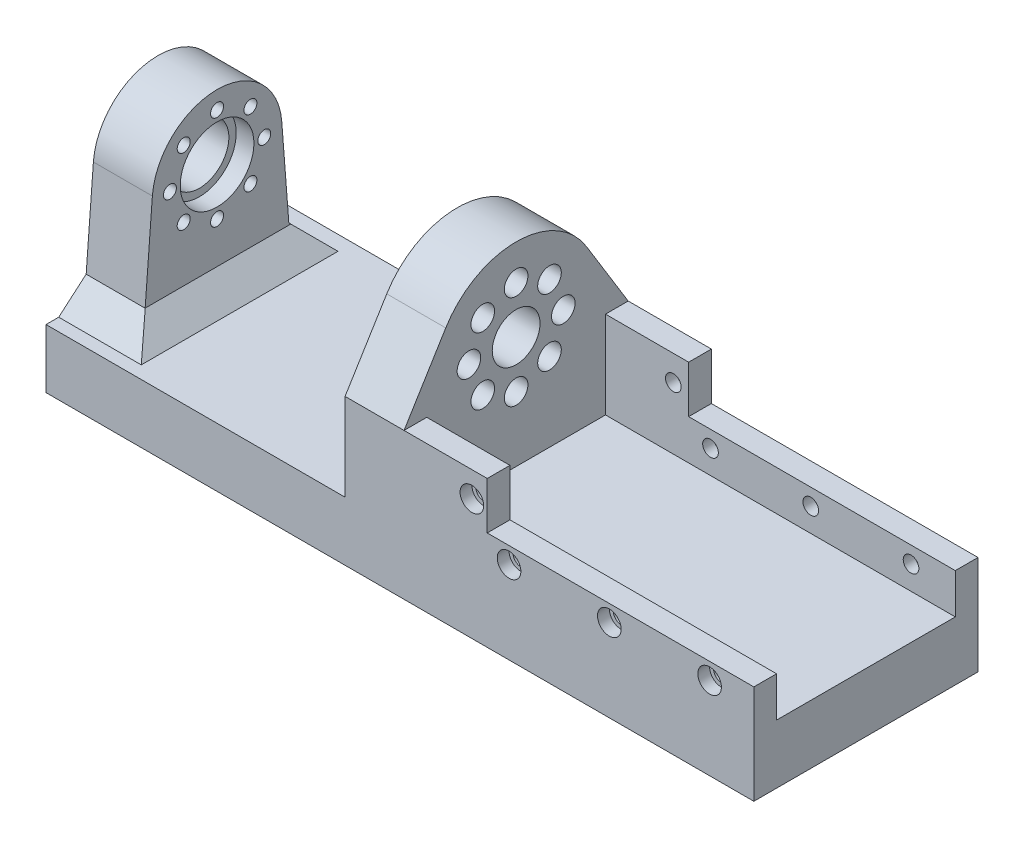
from build123d import *
from OCP.BRepFilletAPI import BRepFilletAPI_MakeChamfer

# Parameters (mm, degrees)
SKETCH1_W                = 120
SKETCH1_H                = 38
BOSS_EXTRUDE1_DEPTH      = 10
SKETCH3_R                = 4.05
BOSS_EXTRUDE2_DEPTH      = 10
SKETCH4_R                = 1.1
CUT_EXTRUDE1_DEPTH       = 133.075735849
SKETCH5_R                = 2
CUT_EXTRUDE2_DEPTH       = 5.6
CIRPATTERN2_COUNT        = 8
MIRROR1_COPY_1_SKETCH_R  = 1.1
MIRROR1_COPY_1_DEPTH     = 133.075735849
MIRROR1_COPY_2_SKETCH_R  = 1.1
MIRROR1_COPY_2_DEPTH     = 133.075735849
MIRROR1_COPY_3_SKETCH_R  = 1.1
MIRROR1_COPY_3_DEPTH     = 133.075735849
MIRROR1_COPY_4_SKETCH_R  = 1.1
MIRROR1_COPY_4_DEPTH     = 133.075735849
MIRROR1_COPY_5_SKETCH_R  = 1.1
MIRROR1_COPY_5_DEPTH     = 133.075735849
MIRROR1_COPY_6_SKETCH_R  = 1.1
MIRROR1_COPY_6_DEPTH     = 133.075735849
MIRROR1_COPY_7_SKETCH_R  = 1.1
MIRROR1_COPY_7_DEPTH     = 133.075735849
MIRROR1_COPY_8_SKETCH_R  = 2
MIRROR1_COPY_8_DEPTH     = 5.6
MIRROR1_COPY_9_SKETCH_R  = 2
MIRROR1_COPY_9_DEPTH     = 5.6
MIRROR1_COPY_10_SKETCH_R = 2
MIRROR1_COPY_10_DEPTH    = 5.6
MIRROR1_COPY_11_SKETCH_R = 2
MIRROR1_COPY_11_DEPTH    = 5.6
MIRROR1_COPY_12_SKETCH_R = 2
MIRROR1_COPY_12_DEPTH    = 5.6
MIRROR1_COPY_13_SKETCH_R = 2
MIRROR1_COPY_13_DEPTH    = 5.6
MIRROR1_COPY_14_SKETCH_R = 2
MIRROR1_COPY_14_DEPTH    = 5.6
SKETCH6_W                = 3.85
SKETCH6_H                = 6.8
BOSS_EXTRUDE3_DEPTH      = 69.3
SKETCH7_R                = 1.325
CUT_EXTRUDE3_DEPTH       = 133.075735849
CHAMFER2_SIZE            = 4
CHAMFER2_SIZE2           = 4.347650763
CHAMFER3_SIZE            = 4
SKETCH10_W               = 24.1
SKETCH10_H               = 8
BOSS_EXTRUDE5_DEPTH      = 3.85
SKETCH12_R               = 1.325
CUT_EXTRUDE5_DEPTH       = 133.075735849
SKETCH13_R               = 2
CUT_EXTRUDE6_DEPTH       = 2
SKETCH14_W               = 24.1
SKETCH14_H               = 8
BOSS_EXTRUDE6_DEPTH      = 3.85
BOSS_EXTRUDE7_DEPTH      = 10
SKETCH17_R               = 6.25
CUT_EXTRUDE8_DEPTH       = 3
SKETCH18_R               = 5
CUT_EXTRUDE9_DEPTH       = 10


with BuildPart() as part:
    # Sketch1 → Boss-Extrude1 (new body)
    with BuildSketch(Plane(origin=(0, 0, 0), x_dir=(1, 0, 0), z_dir=(0, 1, 0))):
        with Locations((60, 19)):
            Rectangle(SKETCH1_W, SKETCH1_H)
    extrude(amount=BOSS_EXTRUDE1_DEPTH)

    # Sketch3 → Boss-Extrude2 (add)
    with BuildSketch(Plane.ZY):
        with BuildLine():
            Line((-29.967346758, 29.846938657), (-31.5, 10))
            Line((-31.5, 10), (-6.5, 10))
            Line((-6.5, 10), (-8.032653242, 29.846938657))
            ThreePointArc((-8.032653242, 29.846938657), (-19, 40), (-29.967346758, 29.846938657))
        make_face()
        with Locations((-19, 29)):
            Circle(SKETCH3_R, mode=Mode.SUBTRACT)
    boss_extrude2 = extrude(amount=-BOSS_EXTRUDE2_DEPTH)

    # Sketch4 → Cut-Extrude1 (cut, through all)
    with BuildSketch(Plane.ZY):
        with Locations((-19, 37)):
            Circle(SKETCH4_R)
    cut_extrude1 = extrude(amount=-CUT_EXTRUDE1_DEPTH, mode=Mode.SUBTRACT)

    # Sketch5 → Cut-Extrude2 (cut)
    with BuildSketch(Plane.ZY):
        with Locations((-19, 37)):
            Circle(SKETCH5_R)
    cut_extrude2 = extrude(amount=-CUT_EXTRUDE2_DEPTH, mode=Mode.SUBTRACT)

    # CirPattern2: Cut-Extrude1, Cut-Extrude2 ×8 about axis
    cirpattern2_axis = Axis((0, 29, -19), (1, 0, 0))
    add([cut_extrude1.rotate(cirpattern2_axis, i * 360 / CIRPATTERN2_COUNT) for i in range(1, CIRPATTERN2_COUNT)], mode=Mode.SUBTRACT)
    add([cut_extrude2.rotate(cirpattern2_axis, i * 360 / CIRPATTERN2_COUNT) for i in range(1, CIRPATTERN2_COUNT)], mode=Mode.SUBTRACT)

    # Mirror1: Boss-Extrude2, Cut-Extrude1, Cut-Extrude2 across plane
    add(boss_extrude2.mirror(Plane(origin=(30.35, 0, 0), x_dir=(0, 0, 1), z_dir=(1, 0, 0))))
    add(cut_extrude1.mirror(Plane(origin=(30.35, 0, 0), x_dir=(0, 0, 1), z_dir=(1, 0, 0))), mode=Mode.SUBTRACT)
    add(cut_extrude2.mirror(Plane(origin=(30.35, 0, 0), x_dir=(0, 0, 1), z_dir=(1, 0, 0))), mode=Mode.SUBTRACT)

    # Mirror1 copy 1 sketch → Mirror1 copy 1 (cut, through all)
    with BuildSketch(Plane(origin=(60.7, -4.941125497, -26.071067812), x_dir=(0, -0.7071067811865475, 0.7071067811865476), z_dir=(1, 0, 0))):
        with Locations((-19, -37)):
            Circle(MIRROR1_COPY_1_SKETCH_R)
    extrude(amount=-MIRROR1_COPY_1_DEPTH, mode=Mode.SUBTRACT)

    # Mirror1 copy 2 sketch → Mirror1 copy 2 (cut, through all)
    with BuildSketch(Plane(origin=(60.7, 10, -48), x_dir=(0, -1, 0), z_dir=(1, 0, 0))):
        with Locations((-19, -37)):
            Circle(MIRROR1_COPY_2_SKETCH_R)
    extrude(amount=-MIRROR1_COPY_2_DEPTH, mode=Mode.SUBTRACT)

    # Mirror1 copy 3 sketch → Mirror1 copy 3 (cut, through all)
    with BuildSketch(Plane(origin=(60.7, 36.071067812, -52.941125497), x_dir=(0, -0.7071067811865476, -0.7071067811865475), z_dir=(1, 0, 0))):
        with Locations((-19, -37)):
            Circle(MIRROR1_COPY_3_SKETCH_R)
    extrude(amount=-MIRROR1_COPY_3_DEPTH, mode=Mode.SUBTRACT)

    # Mirror1 copy 4 sketch → Mirror1 copy 4 (cut, through all)
    with BuildSketch(Plane(origin=(60.7, 58, -38), x_dir=(0, 0, -1), z_dir=(1, 0, 0))):
        with Locations((-19, -37)):
            Circle(MIRROR1_COPY_4_SKETCH_R)
    extrude(amount=-MIRROR1_COPY_4_DEPTH, mode=Mode.SUBTRACT)

    # Mirror1 copy 5 sketch → Mirror1 copy 5 (cut, through all)
    with BuildSketch(Plane(origin=(60.7, 62.941125497, -11.928932188), x_dir=(0, 0.7071067811865475, -0.7071067811865477), z_dir=(1, 0, 0))):
        with Locations((-19, -37)):
            Circle(MIRROR1_COPY_5_SKETCH_R)
    extrude(amount=-MIRROR1_COPY_5_DEPTH, mode=Mode.SUBTRACT)

    # Mirror1 copy 6 sketch → Mirror1 copy 6 (cut, through all)
    with BuildSketch(Plane(origin=(60.7, 48, 10), x_dir=(0, 1, 0), z_dir=(1, 0, 0))):
        with Locations((-19, -37)):
            Circle(MIRROR1_COPY_6_SKETCH_R)
    extrude(amount=-MIRROR1_COPY_6_DEPTH, mode=Mode.SUBTRACT)

    # Mirror1 copy 7 sketch → Mirror1 copy 7 (cut, through all)
    with BuildSketch(Plane(origin=(60.7, 21.928932188, 14.941125497), x_dir=(0, 0.7071067811865477, 0.7071067811865474), z_dir=(1, 0, 0))):
        with Locations((-19, -37)):
            Circle(MIRROR1_COPY_7_SKETCH_R)
    extrude(amount=-MIRROR1_COPY_7_DEPTH, mode=Mode.SUBTRACT)

    # Mirror1 copy 8 sketch → Mirror1 copy 8 (cut)
    with BuildSketch(Plane(origin=(60.7, -4.941125497, -26.071067812), x_dir=(0, -0.7071067811865475, 0.7071067811865476), z_dir=(1, 0, 0))):
        with Locations((-19, -37)):
            Circle(MIRROR1_COPY_8_SKETCH_R)
    extrude(amount=-MIRROR1_COPY_8_DEPTH, mode=Mode.SUBTRACT)

    # Mirror1 copy 9 sketch → Mirror1 copy 9 (cut)
    with BuildSketch(Plane(origin=(60.7, 10, -48), x_dir=(0, -1, 0), z_dir=(1, 0, 0))):
        with Locations((-19, -37)):
            Circle(MIRROR1_COPY_9_SKETCH_R)
    extrude(amount=-MIRROR1_COPY_9_DEPTH, mode=Mode.SUBTRACT)

    # Mirror1 copy 10 sketch → Mirror1 copy 10 (cut)
    with BuildSketch(Plane(origin=(60.7, 36.071067812, -52.941125497), x_dir=(0, -0.7071067811865476, -0.7071067811865475), z_dir=(1, 0, 0))):
        with Locations((-19, -37)):
            Circle(MIRROR1_COPY_10_SKETCH_R)
    extrude(amount=-MIRROR1_COPY_10_DEPTH, mode=Mode.SUBTRACT)

    # Mirror1 copy 11 sketch → Mirror1 copy 11 (cut)
    with BuildSketch(Plane(origin=(60.7, 58, -38), x_dir=(0, 0, -1), z_dir=(1, 0, 0))):
        with Locations((-19, -37)):
            Circle(MIRROR1_COPY_11_SKETCH_R)
    extrude(amount=-MIRROR1_COPY_11_DEPTH, mode=Mode.SUBTRACT)

    # Mirror1 copy 12 sketch → Mirror1 copy 12 (cut)
    with BuildSketch(Plane(origin=(60.7, 62.941125497, -11.928932188), x_dir=(0, 0.7071067811865475, -0.7071067811865477), z_dir=(1, 0, 0))):
        with Locations((-19, -37)):
            Circle(MIRROR1_COPY_12_SKETCH_R)
    extrude(amount=-MIRROR1_COPY_12_DEPTH, mode=Mode.SUBTRACT)

    # Mirror1 copy 13 sketch → Mirror1 copy 13 (cut)
    with BuildSketch(Plane(origin=(60.7, 48, 10), x_dir=(0, 1, 0), z_dir=(1, 0, 0))):
        with Locations((-19, -37)):
            Circle(MIRROR1_COPY_13_SKETCH_R)
    extrude(amount=-MIRROR1_COPY_13_DEPTH, mode=Mode.SUBTRACT)

    # Mirror1 copy 14 sketch → Mirror1 copy 14 (cut)
    with BuildSketch(Plane(origin=(60.7, 21.928932188, 14.941125497), x_dir=(0, 0.7071067811865477, 0.7071067811865474), z_dir=(1, 0, 0))):
        with Locations((-19, -37)):
            Circle(MIRROR1_COPY_14_SKETCH_R)
    extrude(amount=-MIRROR1_COPY_14_DEPTH, mode=Mode.SUBTRACT)

    # Sketch6 → Boss-Extrude3 (add)
    with BuildSketch(Plane(origin=(120, 0, 0), x_dir=(0, 0, -1), z_dir=(1, 0, 0))):
        with Locations((1.925, 13.4)):
            Rectangle(SKETCH6_W, SKETCH6_H)
        with Locations((36.075, 13.4)):
            Rectangle(SKETCH6_W, SKETCH6_H)
    extrude(amount=-BOSS_EXTRUDE3_DEPTH)

    # Sketch7 → Cut-Extrude3 (cut, through all)
    with BuildSketch(Plane.XY):
        with Locations((112.5, 14)):
            Circle(SKETCH7_R)
        with Locations((95.5, 14)):
            Circle(SKETCH7_R)
        with Locations((78.5, 14)):
            Circle(SKETCH7_R)
    extrude(amount=-CUT_EXTRUDE3_DEPTH, mode=Mode.SUBTRACT)

    # Chamfer2: one chamfer whose edges measure the first distance from different faces: ONE call of the kernel's chamfer builder (chamfer() names one face for all edges)
    chamfer2_edges_1 = [part.edges().sort_by_distance(p)[0] for p in [
        (5, 10, -6.5),
    ]]
    chamfer2_side_1 = [part.faces().sort_by_distance(p)[0] for p in [
        (5, 19.923469328, -7.266326621),
    ]]
    chamfer2_edges_2 = [part.edges().sort_by_distance(p)[0] for p in [
        (5, 10, -31.5),
    ]]
    chamfer2_side_2 = [part.faces().sort_by_distance(p)[0] for p in [
        (5, 10, -5.241270482),
    ]]
    chamfer2 = BRepFilletAPI_MakeChamfer(part.part.solid().wrapped)
    for e in chamfer2_edges_1:
        chamfer2.Add(CHAMFER2_SIZE, CHAMFER2_SIZE2, e.wrapped, chamfer2_side_1[0].wrapped)  # the first distance lies on this face
    for e in chamfer2_edges_2:
        chamfer2.Add(CHAMFER2_SIZE, CHAMFER2_SIZE2, e.wrapped, chamfer2_side_2[0].wrapped)  # the first distance lies on this face
    add(Compound.cast(chamfer2.Shape()), mode=Mode.REPLACE)

    # Chamfer3
    # the kernel refuses this chamfer: 4 mm, written as the material it adds along each edge
    with BuildSketch(Plane(origin=(10, 10, -45.786731952), x_dir=(-0.027495876610586487, 0.9996219169112968, 0), z_dir=(0, 0, 1))) as chamfer3_piece_1_section:
        Polygon((CHAMFER3_SIZE * 0.999621916911, -CHAMFER3_SIZE * 0.0274958766106), (-CHAMFER3_SIZE * 0.0274958766106, -CHAMFER3_SIZE * 0.999621916911), (0, 0), align=None)
    chamfer3_piece_1 = extrude(amount=53.921114666, mode=Mode.PRIVATE)
    chamfer3_piece_1 = split(chamfer3_piece_1, bisect_by=Plane(origin=(11.350702775, 12.358006535, -6.682093895), z_dir=(0, -0.07699442332997536, -0.9970315234615627)), keep=Keep.TOP, mode=Mode.PRIVATE)
    chamfer3_piece_1 = split(chamfer3_piece_1, bisect_by=Plane(origin=(11.350702775, 18.198875274, -27.301124726), z_dir=(0, -0.7071067811865462, 0.7071067811865488)), keep=Keep.TOP, mode=Mode.PRIVATE)
    add(chamfer3_piece_1)
    with BuildSketch(Plane(origin=(10, 10, -45.786731952), x_dir=(-0.027495876610586487, 0.9996219169112968, 0), z_dir=(0, 0, 1))) as chamfer3_piece_2_section:
        Polygon((CHAMFER3_SIZE * 0.999621916911, -CHAMFER3_SIZE * 0.0274958766106), (-CHAMFER3_SIZE * 0.0274958766106, -CHAMFER3_SIZE * 0.999621916911), (0, 0), align=None)
    chamfer3_piece_2 = extrude(amount=53.921114666, mode=Mode.PRIVATE)
    chamfer3_piece_2 = split(chamfer3_piece_2, bisect_by=Plane(origin=(11.500745419, 11.803630686, -4.257857977), z_dir=(0, -0.7594510301465996, -0.6505644724462508)), keep=Keep.TOP, mode=Mode.PRIVATE)
    chamfer3_piece_2 = split(chamfer3_piece_2, bisect_by=Plane(origin=(11.500745419, 25.775482122, -19.724517878), z_dir=(0, -0.7071067811865462, 0.7071067811865488)), keep=Keep.TOP, mode=Mode.PRIVATE)
    add(chamfer3_piece_2)
    with BuildSketch(Plane(origin=(50.7, 10, -41.786731952), x_dir=(-0.9996219169112968, -0.02749587661058651, 0), z_dir=(0, 0, 1))) as chamfer3_piece_3_section:
        Polygon((CHAMFER3_SIZE * 0.999621916911, -CHAMFER3_SIZE * 0.0274958766106), (-CHAMFER3_SIZE * 0.0274958766106, -CHAMFER3_SIZE * 0.999621916911), (0, 0), align=None)
    chamfer3_piece_3 = extrude(amount=45.573463904, mode=Mode.PRIVATE)
    chamfer3_piece_3 = split(chamfer3_piece_3, bisect_by=Plane(origin=(49.363898132, 12.279498239, -6.676031197), z_dir=(0, -0.07699442332997536, -0.9970315234615627)), keep=Keep.TOP, mode=Mode.PRIVATE)
    chamfer3_piece_3 = split(chamfer3_piece_3, bisect_by=Plane(origin=(49.363898132, 12.279498239, -31.323968803), z_dir=(0, -0.07699442332997532, 0.9970315234615627)), keep=Keep.TOP, mode=Mode.PRIVATE)
    add(chamfer3_piece_3)

    # Sketch10 → Boss-Extrude5 (add)
    with BuildSketch(Plane.XY):
        with Locations((62.75, 20.8)):
            Rectangle(SKETCH10_W, SKETCH10_H)
    extrude(amount=-BOSS_EXTRUDE5_DEPTH)

    # Sketch12 → Cut-Extrude5 (cut, through all)
    with BuildSketch(Plane.XY):
        with Locations((72.2, 20.5)):
            Circle(SKETCH12_R)
    cut_extrude5 = extrude(amount=-CUT_EXTRUDE5_DEPTH, mode=Mode.SUBTRACT)

    # Sketch13 → Cut-Extrude6 (cut)
    with BuildSketch(Plane.XY):
        with Locations((112.5, 14)):
            Circle(SKETCH13_R)
        with Locations((95.5, 14)):
            Circle(SKETCH13_R)
        with Locations((78.5, 14)):
            Circle(SKETCH13_R)
        with Locations((72.2, 20.5)):
            Circle(SKETCH13_R)
    cut_extrude6 = extrude(amount=-CUT_EXTRUDE6_DEPTH, mode=Mode.SUBTRACT)

    # Sketch14 → Boss-Extrude6 (add)
    with BuildSketch(Plane(origin=(0, 0, -38), x_dir=(-1, 0, 0), z_dir=(0, 0, -1))):
        with Locations((-62.75, 20.8)):
            Rectangle(SKETCH14_W, SKETCH14_H)
    extrude(amount=-BOSS_EXTRUDE6_DEPTH)

    # Sketch15 → Boss-Extrude7 (add)
    with BuildSketch(Plane(origin=(60.7, 0, 0), x_dir=(0, 0, -1), z_dir=(1, 0, 0))):
        with BuildLine():
            Line((0, 24.8), (3.85, 24.8))
            Line((3.85, 24.8), (3.85, 10))
            Line((3.85, 10), (6.5, 10))
            Line((6.5, 10), (8.032653242, 29.846938657))
            ThreePointArc((8.032653242, 29.846938657), (11.527260383, 37.072060617), (19, 40))
            Line((19, 40), (19, 43))
            ThreePointArc((19, 43), (12.161865341, 41.216378939), (7.066107967, 36.319987769))
            Line((7.066107967, 36.319987769), (0, 24.8))
        make_face()
    boss_extrude7 = extrude(amount=-BOSS_EXTRUDE7_DEPTH)

    # Mirror7: Cut-Extrude5, Cut-Extrude6, Boss-Extrude7 across plane
    add(cut_extrude5.mirror(Plane.XY.offset(-19)), mode=Mode.SUBTRACT)
    add(cut_extrude6.mirror(Plane.XY.offset(-19)), mode=Mode.SUBTRACT)
    add(boss_extrude7.mirror(Plane.XY.offset(-19)))

    # Sketch17 → Cut-Extrude8 (cut)
    with BuildSketch(Plane(origin=(10, 0, 0), x_dir=(0, 0, -1), z_dir=(1, 0, 0))):
        with Locations((19, 29)):
            Circle(SKETCH17_R)
    extrude(amount=-CUT_EXTRUDE8_DEPTH, mode=Mode.SUBTRACT)

    # Sketch18 → Cut-Extrude9 (cut)
    with BuildSketch(Plane.ZY):
        with Locations((-19, 29)):
            Circle(SKETCH18_R)
    extrude(amount=-CUT_EXTRUDE9_DEPTH, mode=Mode.SUBTRACT)


solid = part.part
